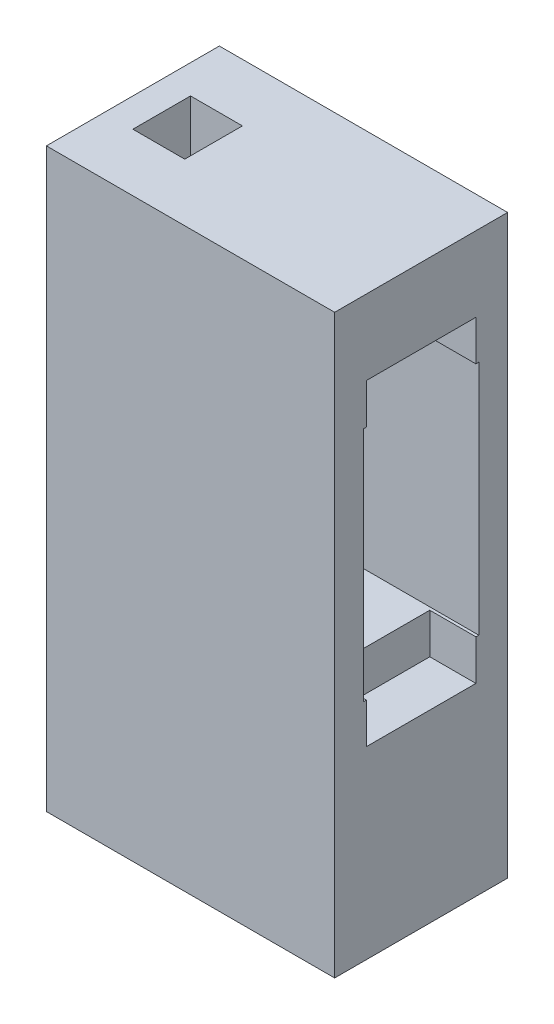
from build123d import *

# Parameters (mm, degrees)
SKETCH_3_W          = 50
SKETCH_3_H          = 30
EXTRUDE_1_DEPTH     = 100
SKETCH_4_W          = 20
SKETCH_4_H          = 41
CUT_EXTRUDE_1_DEPTH = 37
SKETCH_5_W          = 19
SKETCH_5_H          = 7
CUT_EXTRUDE_2_DEPTH = 8
SKETCH_6_W          = 7
SKETCH_6_H          = 7
CUT_EXTRUDE_3_DEPTH = 29
SKETCH_8_W          = 9
SKETCH_8_H          = 10
CUT_EXTRUDE_4_DEPTH = 61
SKETCH_9_W          = 10
SKETCH_9_H          = 10
CUT_EXTRUDE_5_DEPTH = 5
FILLET_1_R          = 5
SKETCH_10_R         = 3
CUT_EXTRUDE_6_DEPTH = 5


with BuildPart() as part:
    # 草圖3 → 填料-伸長1 (new body)
    with BuildSketch(Plane(origin=(0, 0, 0), x_dir=(1, 0, 0), z_dir=(0, 1, 0))):
        with Locations((8, 3)):
            Rectangle(SKETCH_3_W, SKETCH_3_H)
    extrude(amount=EXTRUDE_1_DEPTH)

    # 草圖4 → 除料-伸長1 (cut)
    with BuildSketch(Plane(origin=(33, 0, 0), x_dir=(0, 0, -1), z_dir=(1, 0, 0))):
        with Locations((3, 59.5)):
            Rectangle(SKETCH_4_W, SKETCH_4_H)
    extrude(amount=-CUT_EXTRUDE_1_DEPTH, mode=Mode.SUBTRACT)

    # 草圖5 → 除料-伸長2 (cut)
    with BuildSketch(Plane(origin=(33, 0, 0), x_dir=(0, 0, -1), z_dir=(1, 0, 0))):
        with Locations((3, 83.5)):
            Rectangle(SKETCH_5_W, SKETCH_5_H)
        with Locations((3, 35.5)):
            Rectangle(SKETCH_5_W, SKETCH_5_H)
    extrude(amount=-CUT_EXTRUDE_2_DEPTH, mode=Mode.SUBTRACT)

    # 草圖6 → 除料-伸長3 (cut)
    with BuildSketch(Plane(origin=(25, 0, 0), x_dir=(0, 0, -1), z_dir=(1, 0, 0))):
        with Locations((3, 83.5)):
            Rectangle(SKETCH_6_W, SKETCH_6_H)
    extrude(amount=-CUT_EXTRUDE_3_DEPTH, mode=Mode.SUBTRACT)

    # 草圖8 → 除料-伸長4 (cut)
    with BuildSketch(Plane(origin=(0, 100, 0), x_dir=(1, 0, 0), z_dir=(0, 1, 0))):
        with Locations((-7.5, 3)):
            Rectangle(SKETCH_8_W, SKETCH_8_H)
    extrude(amount=-CUT_EXTRUDE_4_DEPTH, mode=Mode.SUBTRACT)

    # 草圖9 → 除料-伸長5 (cut)
    with BuildSketch(Plane.ZY.offset(17)):
        with Locations((-3, 44)):
            Rectangle(SKETCH_9_W, SKETCH_9_H)
    extrude(amount=-CUT_EXTRUDE_5_DEPTH, mode=Mode.SUBTRACT)

    # 圓角1
    fillet_1_edges = [part.edges().sort_by_distance(p)[0] for p in [
        (-12, 49, -3),
    ]]
    fillet(fillet_1_edges, radius=FILLET_1_R - 0.0001)  # a hair under: the kernel refuses the full size

    # 草圖10 → 除料-伸長6 (cut)
    with BuildSketch(Plane.ZY.offset(17)):
        with Locations((-2.038456717, 71)):
            Circle(SKETCH_10_R)
    extrude(amount=-CUT_EXTRUDE_6_DEPTH, mode=Mode.SUBTRACT)


solid = part.part
